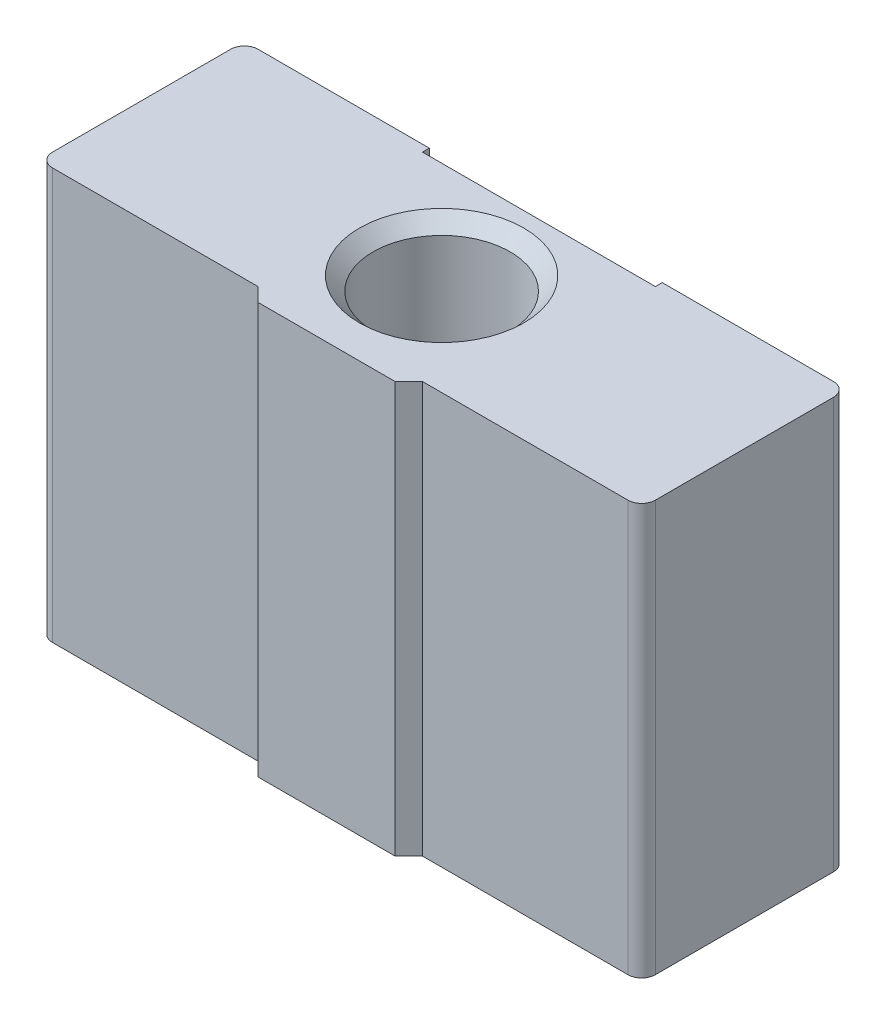
from build123d import *

# Parameters (mm, degrees)
EXTRUDE_1_DEPTH     = 30
SKETCH_2_R          = 5
CUT_EXTRUDE_1_DEPTH = 30
M5X0_5_1_D          = 4.5
M5X0_5_1_DEPTH      = 10
M5X0_5_1_TIP        = 1.351936393
SKETCH_7_W          = 17
SKETCH_7_H          = 0.5
CUT_EXTRUDE_2_DEPTH = 41.496913463
CHAMFER_1_SIZE      = 1
FILLET_1_R          = 1


with BuildPart() as part:
    # 草图1 → 凸台-拉伸1 (new body)
    with BuildSketch(Plane(origin=(0, 0, 0), x_dir=(1, 0, 0), z_dir=(0, 1, 0))):
        Polygon((-22, 0), (22, 0), (22, -15), (5, -15), (5, -16), (-5, -16), (-5, -15), (-22, -15), align=None)
    extrude(amount=EXTRUDE_1_DEPTH)

    # 草图2 → 切除-拉伸1 (cut)
    with BuildSketch(Plane.XZ):
        with Locations(Location((0, 7.6, 0), (0, 0, 270))):
            Circle(SKETCH_2_R)
    extrude(amount=-CUT_EXTRUDE_1_DEPTH, mode=Mode.SUBTRACT)

    # M5X0.5 螺纹孔的螺纹孔钻头1
    with Locations(Plane(origin=(0, 0, 0), x_dir=(-1, 0, 0), z_dir=(0, 0, -1))):
        with Locations((-16, 24), (16, 24), (16, 6), (-16, 6)):
            Hole(M5X0_5_1_D / 2, depth=M5X0_5_1_DEPTH)
            with Locations((0, 0, -(M5X0_5_1_DEPTH + M5X0_5_1_TIP / 2))):  # 118° drill point
                Cone(0, M5X0_5_1_D / 2, M5X0_5_1_TIP, mode=Mode.SUBTRACT)

    # 草图7 → 切除-拉伸2 (cut, through all)
    with BuildSketch(Plane.XZ):
        with Locations((0, 0.25)):
            Rectangle(SKETCH_7_W, SKETCH_7_H)
    extrude(amount=-CUT_EXTRUDE_2_DEPTH, mode=Mode.SUBTRACT)

    # 倒角1
    chamfer_1_edges = [part.edges().sort_by_distance(p)[0] for p in [
        (-5, 15, 15),
        (5, 15, 15),
        (0, 30, 12.6),
        (0, 0, 12.6),
    ]]
    chamfer(chamfer_1_edges, length=CHAMFER_1_SIZE - 0.0001)  # a hair under: the kernel refuses the full size

    # 圆角1
    fillet_1_edges = [part.edges().sort_by_distance(p)[0] for p in [
        (-22, 15, 15),
        (-22, 15, 0),
        (22, 15, 0),
        (22, 15, 15),
    ]]
    fillet(fillet_1_edges, radius=FILLET_1_R)


solid = part.part
